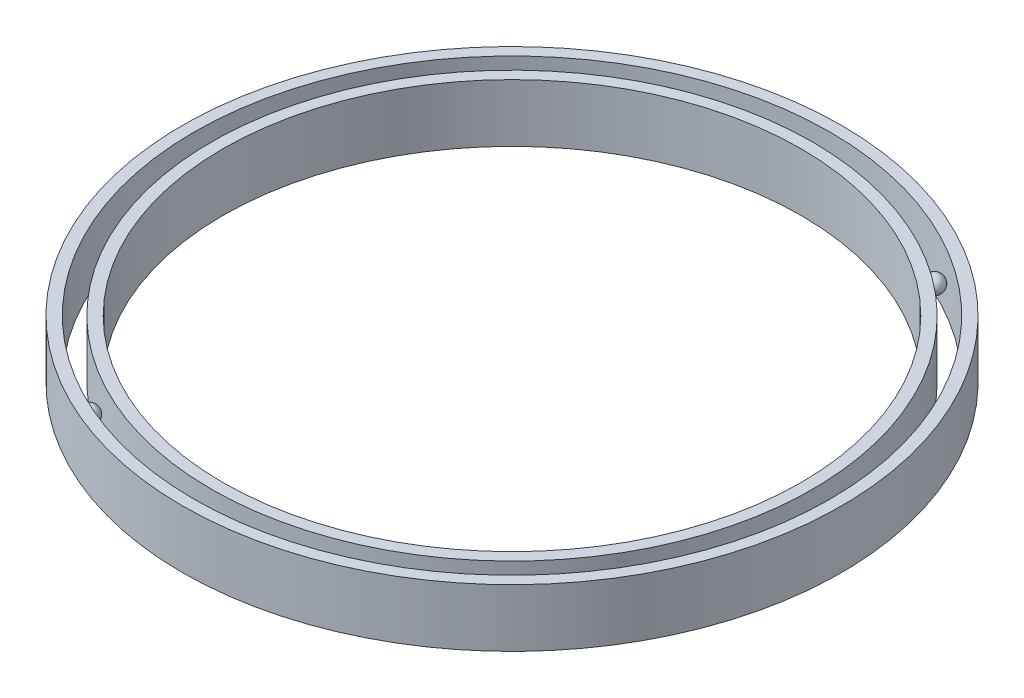
from build123d import *

# Parameters (mm, degrees)
SKETCH1_W         = 4
SKETCH1_H         = 20
SKETCH2_W         = 4
SKETCH2_H         = 20
CIRPATTERN1_COUNT = 6


with BuildPart() as part:
    # Sketch1 → Revolve1 (revolve)
    with BuildSketch(Plane.XY):
        with Locations((102, 0)):
            Rectangle(SKETCH1_W, SKETCH1_H)
    revolve(axis=Axis((0, 0, 0), (0, 1, 0)))


with BuildPart() as body_2:
    # Sketch2 → Revolve2 (revolve)
    with BuildSketch(Plane.XY):
        with Locations((112, 0)):
            Rectangle(SKETCH2_W, SKETCH2_H)
    revolve(axis=Axis((0, 0, 0), (0, 1, 0)))


with BuildPart() as body_3:
    # Sketch3 → Revolve3 (revolve)
    with BuildSketch(Plane(origin=(0, 0, 0), x_dir=(1, 0, 0), z_dir=(0, 1, 0))):
        with BuildLine():
            Line((104, 0), (110, 0))
            ThreePointArc((110, 0), (107, 3), (104, 0))
        make_face()
    revolve(axis=Axis((104, 0, 0), (1, 0, 0)))


with BuildPart() as cirpattern1_1:
    # CirPattern1: pattern copy
    add(body_3.part.rotate(Axis((0, 10, 0), (0, -1, 0)), 1 * 360 / CIRPATTERN1_COUNT))


with BuildPart() as cirpattern1_2:
    # CirPattern1: pattern copy
    add(body_3.part.rotate(Axis((0, 10, 0), (0, -1, 0)), 2 * 360 / CIRPATTERN1_COUNT))


with BuildPart() as cirpattern1_3:
    # CirPattern1: pattern copy
    add(body_3.part.rotate(Axis((0, 10, 0), (0, -1, 0)), 3 * 360 / CIRPATTERN1_COUNT))


with BuildPart() as cirpattern1_4:
    # CirPattern1: pattern copy
    add(body_3.part.rotate(Axis((0, 10, 0), (0, -1, 0)), 4 * 360 / CIRPATTERN1_COUNT))


with BuildPart() as cirpattern1_5:
    # CirPattern1: pattern copy
    add(body_3.part.rotate(Axis((0, 10, 0), (0, -1, 0)), 5 * 360 / CIRPATTERN1_COUNT))


solid = Compound([part.part, body_2.part, body_3.part, cirpattern1_1.part, cirpattern1_2.part, cirpattern1_3.part, cirpattern1_4.part, cirpattern1_5.part])
